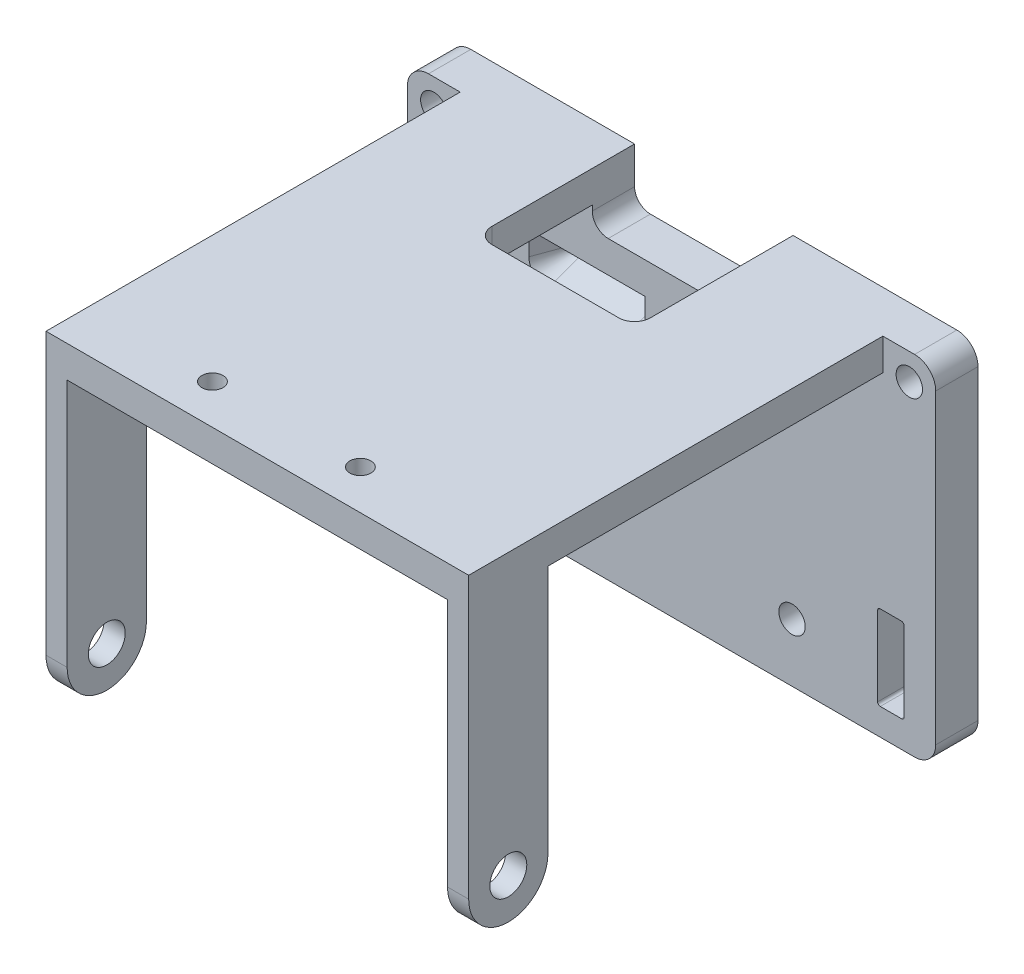
from build123d import *

# Parameters (mm, degrees)
SKETCH1_W             = 40
SKETCH1_H             = 33
BOSS_EXTRUDE1_DEPTH   = 4
SKETCH3_W             = 40
SKETCH3_H             = 3
BOSS_EXTRUDE2_DEPTH   = 39.2
SKETCH10_W            = 2
SKETCH10_H            = 7.5
BOSS_EXTRUDE3_DEPTH   = 27.3
SKETCH12_W            = 4
SKETCH12_H            = 33
BOSS_EXTRUDE4_DEPTH   = 5
SKETCH13_W            = 2.5
SKETCH13_H            = 8
CUT_EXTRUDE5_DEPTH    = 50.856193196
CUT_EXTRUDE6_REACH    = 63.565
SKETCH15_R            = 1.75
FILLET6_R             = 3.75
CUT_EXTRUDE8_REACH    = 51.856
SKETCH23_R            = 1.25
FILLET8_R             = 2
SKETCH25_R            = 1
CUT_EXTRUDE10_DEPTH   = 59.234354122
SKETCH26_W            = 8
SKETCH26_H            = 2.5
CUT_EXTRUDE11_DEPTH   = 50.856193196
FILLET3_R             = 0.25
FILLET6_OF_MIRROR10_R = 3.75
FILLET8_OF_MIRROR10_R = 2
SKETCH28_W            = 8
SKETCH28_H            = 2.5
CUT_EXTRUDE12_DEPTH   = 50.856193196
FILLET9_R             = 0.25
CHAMFER1_SIZE         = 1.5
CHAMFER1_SIZE_2       = 4.121216129
CHAMFER2_SIZE         = 9.470627272
CHAMFER2_SIZE_2       = 1.5
SKETCH29_W            = 15
SKETCH29_H            = 15
CUT_EXTRUDE13_DEPTH   = 5
FILLET10_R            = 1.5


# Some blends are built 0.0001 mm under size
with BuildPart() as part:
    # Sketch1 → Boss-Extrude1 (new body)
    with BuildSketch(Plane.XY):
        with Locations((0, -1.5)):
            Rectangle(SKETCH1_W, SKETCH1_H)
    extrude(amount=BOSS_EXTRUDE1_DEPTH)

    # Sketch3 → Boss-Extrude2 (add)
    with BuildSketch(Plane.XY.offset(4)):
        with Locations((0, 13.5)):
            Rectangle(SKETCH3_W, SKETCH3_H)
    extrude(amount=BOSS_EXTRUDE2_DEPTH)

    # Sketch10 → Boss-Extrude3 (add)
    with BuildSketch(Plane.XZ.offset(-12)):
        with Locations((19, 39.45)):
            Rectangle(SKETCH10_W, SKETCH10_H)
    boss_extrude3 = extrude(amount=BOSS_EXTRUDE3_DEPTH)

    # Sketch12 → Boss-Extrude4 (add)
    with BuildSketch(Plane(origin=(20, 0, 0), x_dir=(0, 0, -1), z_dir=(1, 0, 0))):
        with Locations((-2, -1.5)):
            Rectangle(SKETCH12_W, SKETCH12_H)
    boss_extrude4 = extrude(amount=BOSS_EXTRUDE4_DEPTH)

    # Sketch13 → Cut-Extrude5 (cut, through all)
    with BuildSketch(Plane.XY.offset(4)):
        with Locations((20.75, -11.475)):
            Rectangle(SKETCH13_W, SKETCH13_H)
    cut_extrude5 = extrude(amount=-CUT_EXTRUDE5_DEPTH, mode=Mode.SUBTRACT)

    # Sketch15 → Cut-Extrude6 (cut, up to next)
    with BuildSketch(Plane(origin=(20, 0, 0), x_dir=(0, 0, -1), z_dir=(1, 0, 0)), mode=Mode.PRIVATE) as cut_extrude6_sk1:
        with Locations((-39.45, -11.475)):
            Circle(SKETCH15_R)
    cut_extrude6_tool1 = extrude(cut_extrude6_sk1.sketch, amount=-CUT_EXTRUDE6_REACH, mode=Mode.PRIVATE) & part.part
    cut_extrude6 = cut_extrude6_tool1.solids().sort_by_distance((20, -11.475, 39.45))[0]
    add(cut_extrude6, mode=Mode.SUBTRACT)

    # Fillet6
    fillet6_edges = [part.edges().sort_by_distance(p)[0] for p in [
        (19, -15.3, 35.7),
        (19, -15.3, 43.2),
    ]]
    fillet(fillet6_edges, radius=FILLET6_R - 0.0001)  # a hair under: the kernel refuses the full size

    # Sketch23 → Cut-Extrude8 (cut, up to next)
    with BuildSketch(Plane.XY.offset(4), mode=Mode.PRIVATE) as cut_extrude8_sk1:
        with Locations((11.4, -12.5)):
            Circle(SKETCH23_R)
    cut_extrude8_tool1 = extrude(cut_extrude8_sk1.sketch, amount=-CUT_EXTRUDE8_REACH, mode=Mode.PRIVATE) & part.part
    # Sketch23 → Cut-Extrude8 (cut, up to next)
    with BuildSketch(Plane.XY.offset(4), mode=Mode.PRIVATE) as cut_extrude8_sk2:
        with Locations((22.5, 12.5)):
            Circle(SKETCH23_R)
    cut_extrude8_tool2 = extrude(cut_extrude8_sk2.sketch, amount=-CUT_EXTRUDE8_REACH, mode=Mode.PRIVATE) & part.part
    cut_extrude8_1 = cut_extrude8_tool1.solids().sort_by_distance((11.4, -12.5, 4))[0]
    add(cut_extrude8_1, mode=Mode.SUBTRACT)
    cut_extrude8_2 = cut_extrude8_tool2.solids().sort_by_distance((22.5, 12.5, 4))[0]
    add(cut_extrude8_2, mode=Mode.SUBTRACT)
    cut_extrude8 = cut_extrude8_1 + cut_extrude8_2  # Cut-Extrude8 as one shape, for the pattern or mirror that repeats it

    # Fillet8
    fillet8_edges = [part.edges().sort_by_distance(p)[0] for p in [
        (25, 15, 2),
        (25, -18, 2),
    ]]
    fillet(fillet8_edges, radius=FILLET8_R)

    # Sketch25 → Cut-Extrude10 (cut, through all)
    with BuildSketch(Plane.XZ.offset(-12)):
        with Locations(Location((6, 39.45, 0), (0, 0, 270))):
            Circle(SKETCH25_R)
        with Locations(Location((-8, 39.45, 0), (0, 0, 270))):
            Circle(SKETCH25_R)
    extrude(amount=-CUT_EXTRUDE10_DEPTH, mode=Mode.SUBTRACT)

    # Sketch26 → Cut-Extrude11 (cut, through all)
    with BuildSketch(Plane.XY.offset(4)):
        with Locations((6, 5.75)):
            Rectangle(SKETCH26_W, SKETCH26_H)
    extrude(amount=-CUT_EXTRUDE11_DEPTH, mode=Mode.SUBTRACT)

    # Fillet3
    fillet3_edges = [part.edges().sort_by_distance(p)[0] for p in [
        (22, -7.475, 2),
        (22, -15.475, 2),
        (19.5, -15.475, 2),
        (19.5, -7.475, 2),
    ]]
    fillet(fillet3_edges, radius=FILLET3_R)

    # Mirror10: Boss-Extrude3, Boss-Extrude4, Cut-Extrude5, Cut-Extrude6, Cut-Extrude8 across plane
    add(boss_extrude3.mirror(Plane(origin=(0, 0, 0), x_dir=(0, 0, 1), z_dir=(1, 0, 0))))
    add(boss_extrude4.mirror(Plane(origin=(0, 0, 0), x_dir=(0, 0, 1), z_dir=(1, 0, 0))))
    add(cut_extrude5.mirror(Plane(origin=(0, 0, 0), x_dir=(0, 0, 1), z_dir=(1, 0, 0))), mode=Mode.SUBTRACT)
    add(cut_extrude6.mirror(Plane(origin=(0, 0, 0), x_dir=(0, 0, 1), z_dir=(1, 0, 0))), mode=Mode.SUBTRACT)
    add(cut_extrude8.mirror(Plane(origin=(0, 0, 0), x_dir=(0, 0, 1), z_dir=(1, 0, 0))), mode=Mode.SUBTRACT)

    # Fillet6 of Mirror10
    fillet6_of_mirror10_edges = [part.edges().sort_by_distance(p)[0] for p in [
        (-19, -15.3, 35.7),
        (-19, -15.3, 43.2),
    ]]
    fillet(fillet6_of_mirror10_edges, radius=FILLET6_OF_MIRROR10_R - 0.0001)  # a hair under: the kernel refuses the full size

    # Fillet8 of Mirror10
    fillet8_of_mirror10_edges = [part.edges().sort_by_distance(p)[0] for p in [
        (-25, 15, 2),
        (-25, -18, 2),
    ]]
    fillet(fillet8_of_mirror10_edges, radius=FILLET8_OF_MIRROR10_R)

    # Sketch28 → Cut-Extrude12 (cut, through all)
    with BuildSketch(Plane.XY.offset(4)):
        with Locations((-8, 5.75)):
            Rectangle(SKETCH28_W, SKETCH28_H)
    extrude(amount=-CUT_EXTRUDE12_DEPTH, mode=Mode.SUBTRACT)

    # Fillet9
    fillet9_edges = [part.edges().sort_by_distance(p)[0] for p in [
        (10, 4.5, 2),
        (2, 4.5, 2),
        (-12, 4.5, 2),
        (-4, 4.5, 2),
    ]]
    fillet(fillet9_edges, radius=FILLET9_R)

    # Chamfer1
    # the kernel refuses this chamfer: 4.121216129, 1.5 mm, written as the material it takes off along each edge
    with BuildSketch(Plane(origin=(-12, 4.75, 4), x_dir=(-0.9950833631817486, 0, 0.09904090225205062), z_dir=(0, 1, 0)), Plane(origin=(-4, 7, 4), x_dir=(0.9950833631817486, 0, 0.09904090225205064), z_dir=(0, -1, 0))) as chamfer1_piece_1:
        Polygon((CHAMFER1_SIZE * 0.995083363182, -CHAMFER1_SIZE * 0.0990409022521), (-CHAMFER1_SIZE_2 * 0.0990409022564, -CHAMFER1_SIZE_2 * 0.995083363226), (0, 0), align=None)
    extrude(amount=2.25, mode=Mode.SUBTRACT)
    with BuildSketch(Plane(origin=(-11.75, 4.75, 4), x_dir=(-1, 0, 0), z_dir=(0, 1, 0))) as chamfer1_piece_2:
        Polygon((0.25 + CHAMFER1_SIZE, 0), (0.25, -CHAMFER1_SIZE_2), (0.25, 0), align=None)
    revolve(axis=Axis((-11.75, 4.75, 4), (0, 0, 1)), revolution_arc=90, mode=Mode.SUBTRACT)
    with BuildSketch(Plane(origin=(-4.25, 4.75, 4), x_dir=(0, -1, 0), z_dir=(-1, 0, 0))) as chamfer1_piece_3:
        Polygon((0.25 + CHAMFER1_SIZE, 0), (0.25, -CHAMFER1_SIZE_2), (0.25, 0), align=None)
    revolve(axis=Axis((-4.25, 4.75, 4), (0, 0, 1)), revolution_arc=90, mode=Mode.SUBTRACT)
    with BuildSketch(Plane(origin=(-4.25, 4.5, 4), x_dir=(0, -0.9950833631817486, 0.09904090225205064), z_dir=(-1, 0, 0))) as chamfer1_piece_4:
        Polygon((CHAMFER1_SIZE * 0.995083363182, -CHAMFER1_SIZE * 0.0990409022521), (-CHAMFER1_SIZE_2 * 0.0990409022564, -CHAMFER1_SIZE_2 * 0.995083363226), (0, 0), align=None)
    extrude(amount=7.5, mode=Mode.SUBTRACT)

    # Chamfer2
    # the kernel refuses this chamfer: 9.470627272, 1.5 mm, written as the material it takes off along each edge
    with BuildSketch(Plane(origin=(2, 7, 0), x_dir=(0.006019451551713046, 0, 0.9999818829373942), z_dir=(0, -1, 0)), Plane(origin=(10, 4.75, 0), x_dir=(-0.006019451551713001, 0, 0.9999818829373942), z_dir=(0, 1, 0))) as chamfer2_piece_1:
        Polygon((CHAMFER2_SIZE * 0.999981882939, CHAMFER2_SIZE * 0.00601945155172), (-CHAMFER2_SIZE_2 * 0.00601945155171, CHAMFER2_SIZE_2 * 0.999981882937), (0, 0), align=None)
    extrude(amount=2.25, mode=Mode.SUBTRACT)
    with BuildSketch(Plane(origin=(2.25, 4.75, 0), x_dir=(-1, 0, 0), z_dir=(0, 1, 0))) as chamfer2_piece_2:
        Polygon((0.25, CHAMFER2_SIZE), (0.25 + CHAMFER2_SIZE_2, 0), (0.25, 0), align=None)
    revolve(axis=Axis((2.25, 4.75, 0), (0, 0, 1)), revolution_arc=90, mode=Mode.SUBTRACT)
    with BuildSketch(Plane(origin=(9.75, 4.75, 0), x_dir=(1, 0, 0), z_dir=(0, 1, 0))) as chamfer2_piece_3:
        Polygon((0.25, -CHAMFER2_SIZE), (0.25 + CHAMFER2_SIZE_2, 0), (0.25, 0), align=None)
    revolve(axis=Axis((9.75, 4.75, 0), (0, 0, -1)), revolution_arc=90, mode=Mode.SUBTRACT)
    with BuildSketch(Plane(origin=(2.25, 4.5, 0), x_dir=(0, 0.006019451551713091, 0.9999818829373942), z_dir=(1, 0, 0))) as chamfer2_piece_4:
        Polygon((CHAMFER2_SIZE * 0.999981882939, CHAMFER2_SIZE * 0.00601945155172), (-CHAMFER2_SIZE_2 * 0.00601945155171, CHAMFER2_SIZE_2 * 0.999981882937), (0, 0), align=None)
    extrude(amount=7.5, mode=Mode.SUBTRACT)

    # Sketch29 → Cut-Extrude13 (cut)
    with BuildSketch(Plane(origin=(0, 15, 0), x_dir=(1, 0, 0), z_dir=(0, 1, 0))):
        with Locations((0, -7.5)):
            Rectangle(SKETCH29_W, SKETCH29_H)
    extrude(amount=-CUT_EXTRUDE13_DEPTH, mode=Mode.SUBTRACT)

    # Fillet10
    fillet10_edges = [part.edges().sort_by_distance(p)[0] for p in [
        (-7.5, 10, 2),
        (-7.5, 13.5, 15),
        (7.5, 10, 2),
        (7.5, 13.5, 15),
    ]]
    fillet(fillet10_edges, radius=FILLET10_R)


solid = part.part
